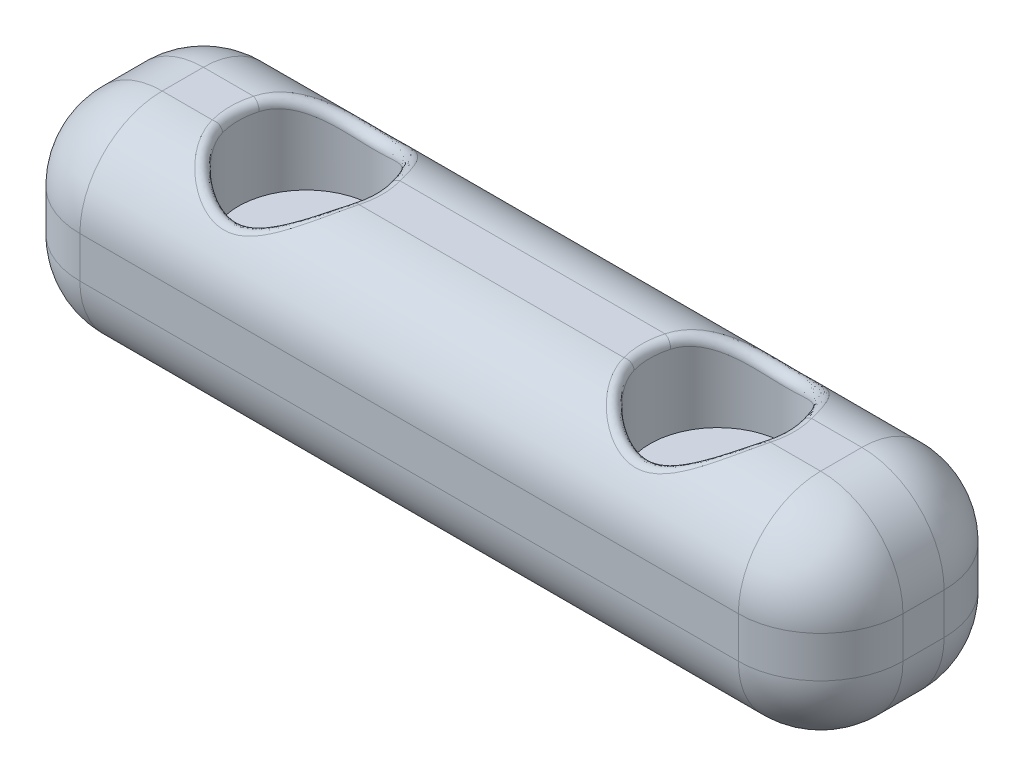
from build123d import *

# Parameters (mm, degrees)
SKETCH1_W           = 20
SKETCH1_H           = 5
BOSS_EXTRUDE1_DEPTH = 5
SKETCH2_R           = 1.65
CUT_EXTRUDE1_DEPTH  = 2
FILLET1_R           = 2
FILLET2_R           = 0.2


with BuildPart() as part:
    # Sketch1 → Boss-Extrude1 (new body)
    with BuildSketch(Plane(origin=(0, 0, 0), x_dir=(1, 0, 0), z_dir=(0, 1, 0))):
        with Locations((0.862068966, 0.646551724)):
            Rectangle(SKETCH1_W, SKETCH1_H)
    extrude(amount=BOSS_EXTRUDE1_DEPTH)

    # Sketch2 → Cut-Extrude1 (cut)
    with BuildSketch(Plane(origin=(0, 5, 0), x_dir=(1, 0, 0), z_dir=(0, 1, 0))):
        with Locations(Location((-4.137931034, 0.646551724, 0), (0, 0, 270))):
            Circle(SKETCH2_R)
        with Locations(Location((5.862068966, 0.646551724, 0), (0, 0, 270))):
            Circle(SKETCH2_R)
    extrude(amount=-CUT_EXTRUDE1_DEPTH, mode=Mode.SUBTRACT)

    # Fillet1
    # the kernel refuses this fillet: 2 mm, written as the material it takes off along each edge
    with BuildSketch(Plane(origin=(8.862068966, 3, -1.146551724), x_dir=(1, 0, 0), z_dir=(0, 0, -1))) as fillet1_piece_1_section:
        Polygon((0, 0), (FILLET1_R, 0), (FILLET1_R, -FILLET1_R), (0, -FILLET1_R), align=None)
    fillet1_piece_1 = extrude(amount=FILLET1_R, mode=Mode.PRIVATE)
    fillet1_piece_1 = fillet1_piece_1 - Plane(origin=(8.862068966, 3, -1.146551724), x_dir=(-0.7071067811865475, -0.7071067811865475, 0), z_dir=(0, 0, -1)) * Sphere(FILLET1_R, mode=Mode.PRIVATE)
    add(fillet1_piece_1, mode=Mode.SUBTRACT)
    with BuildSketch(Plane(origin=(8.862068966, 3, -0.146551724), x_dir=(0, 1, 0), z_dir=(1, 0, 0))) as fillet1_piece_2_section:
        Polygon((0, 0), (FILLET1_R, 0), (FILLET1_R, FILLET1_R), (0, FILLET1_R), align=None)
    fillet1_piece_2 = extrude(amount=FILLET1_R, mode=Mode.PRIVATE)
    fillet1_piece_2 = fillet1_piece_2 - Plane(origin=(8.862068966, 3, -0.146551724), x_dir=(0, -0.7071067811865475, -0.7071067811865475), z_dir=(1, 0, 0)) * Sphere(FILLET1_R, mode=Mode.PRIVATE)
    add(fillet1_piece_2, mode=Mode.SUBTRACT)
    with BuildSketch(Plane(origin=(-7.137931034, 3, -1.146551724), x_dir=(-1, 0, 0), z_dir=(0, 0, -1))) as fillet1_piece_3_section:
        Polygon((0, 0), (FILLET1_R, 0), (FILLET1_R, FILLET1_R), (0, FILLET1_R), align=None)
    fillet1_piece_3 = extrude(amount=FILLET1_R, mode=Mode.PRIVATE)
    fillet1_piece_3 = fillet1_piece_3 - Plane(origin=(-7.137931034, 3, -1.146551724), x_dir=(0.7071067811865475, -0.7071067811865475, 0), z_dir=(0, 0, -1)) * Sphere(FILLET1_R, mode=Mode.PRIVATE)
    add(fillet1_piece_3, mode=Mode.SUBTRACT)
    with BuildSketch(Plane(origin=(-7.137931034, 3, -0.146551724), x_dir=(0, 1, 0), z_dir=(-1, 0, 0))) as fillet1_piece_4_section:
        Polygon((0, 0), (FILLET1_R, 0), (FILLET1_R, -FILLET1_R), (0, -FILLET1_R), align=None)
    fillet1_piece_4 = extrude(amount=FILLET1_R, mode=Mode.PRIVATE)
    fillet1_piece_4 = fillet1_piece_4 - Plane(origin=(-7.137931034, 3, -0.146551724), x_dir=(0, -0.7071067811865475, -0.7071067811865475), z_dir=(-1, 0, 0)) * Sphere(FILLET1_R, mode=Mode.PRIVATE)
    add(fillet1_piece_4, mode=Mode.SUBTRACT)
    with BuildSketch(Plane(origin=(-7.137931034, 2, -1.146551724), x_dir=(-1, 0, 0), z_dir=(0, 0, -1))) as fillet1_piece_5_section:
        Polygon((0, 0), (FILLET1_R, 0), (FILLET1_R, -FILLET1_R), (0, -FILLET1_R), align=None)
    fillet1_piece_5 = extrude(amount=FILLET1_R, mode=Mode.PRIVATE)
    fillet1_piece_5 = fillet1_piece_5 - Plane(origin=(-7.137931034, 2, -1.146551724), x_dir=(0.7071067811865475, 0.7071067811865475, 0), z_dir=(0, 0, -1)) * Sphere(FILLET1_R, mode=Mode.PRIVATE)
    add(fillet1_piece_5, mode=Mode.SUBTRACT)
    with BuildSketch(Plane(origin=(8.862068966, 2, -1.146551724), x_dir=(1, 0, 0), z_dir=(0, 0, -1))) as fillet1_piece_6_section:
        Polygon((0, 0), (FILLET1_R, 0), (FILLET1_R, FILLET1_R), (0, FILLET1_R), align=None)
    fillet1_piece_6 = extrude(amount=FILLET1_R, mode=Mode.PRIVATE)
    fillet1_piece_6 = fillet1_piece_6 - Plane(origin=(8.862068966, 2, -1.146551724), x_dir=(-0.7071067811865475, 0.7071067811865475, 0), z_dir=(0, 0, -1)) * Sphere(FILLET1_R, mode=Mode.PRIVATE)
    add(fillet1_piece_6, mode=Mode.SUBTRACT)
    with BuildSketch(Plane(origin=(8.862068966, 2, -0.146551724), x_dir=(0, -1, 0), z_dir=(1, 0, 0))) as fillet1_piece_7_section:
        Polygon((0, 0), (FILLET1_R, 0), (FILLET1_R, -FILLET1_R), (0, -FILLET1_R), align=None)
    fillet1_piece_7 = extrude(amount=FILLET1_R, mode=Mode.PRIVATE)
    fillet1_piece_7 = fillet1_piece_7 - Plane(origin=(8.862068966, 2, -0.146551724), x_dir=(0, 0.7071067811865475, -0.7071067811865475), z_dir=(1, 0, 0)) * Sphere(FILLET1_R, mode=Mode.PRIVATE)
    add(fillet1_piece_7, mode=Mode.SUBTRACT)
    with BuildSketch(Plane(origin=(-7.137931034, 2, -0.146551724), x_dir=(0, -1, 0), z_dir=(-1, 0, 0))) as fillet1_piece_8_section:
        Polygon((0, 0), (FILLET1_R, 0), (FILLET1_R, FILLET1_R), (0, FILLET1_R), align=None)
    fillet1_piece_8 = extrude(amount=FILLET1_R, mode=Mode.PRIVATE)
    fillet1_piece_8 = fillet1_piece_8 - Plane(origin=(-7.137931034, 2, -0.146551724), x_dir=(0, 0.7071067811865475, -0.7071067811865475), z_dir=(-1, 0, 0)) * Sphere(FILLET1_R, mode=Mode.PRIVATE)
    add(fillet1_piece_8, mode=Mode.SUBTRACT)
    with BuildSketch(Plane(origin=(10.862068966, 5, -1.146551724), x_dir=(0, -1, 0), z_dir=(0, 0, 1)), Plane(origin=(-9.137931034, 5, -0.146551724), x_dir=(0, -1, 0), z_dir=(0, 0, -1)), Plane(origin=(-9.137931034, 2, -3.146551724), x_dir=(1, 0, 0), z_dir=(0, 1, 0)), Plane(origin=(-9.137931034, 2, 1.853448276), x_dir=(0, 0, -1), z_dir=(0, 1, 0))) as fillet1_piece_9:
        with BuildLine():
            CenterArc((FILLET1_R, -FILLET1_R), FILLET1_R, 90, 90)
            Line((0, -FILLET1_R), (0, 0))
            Line((0, 0), (FILLET1_R, 0))
        make_face()
    extrude(amount=1, mode=Mode.SUBTRACT)
    with BuildSketch(Plane(origin=(-7.137931034, 5, -3.146551724), x_dir=(0, -1, 0), z_dir=(1, 0, 0)), Plane(origin=(8.862068966, 0, 1.853448276), x_dir=(0, 0, -1), z_dir=(-1, 0, 0))) as fillet1_piece_10:
        with BuildLine():
            CenterArc((FILLET1_R, -FILLET1_R), FILLET1_R, 90, 90)
            Line((0, -FILLET1_R), (0, 0))
            Line((0, 0), (FILLET1_R, 0))
        make_face()
    extrude(amount=16, mode=Mode.SUBTRACT)
    with BuildSketch(Plane(origin=(-7.137931034, 0, -3.146551724), x_dir=(0, 1, 0), z_dir=(1, 0, 0)), Plane(origin=(8.862068966, 5, 1.853448276), x_dir=(0, 0, -1), z_dir=(-1, 0, 0))) as fillet1_piece_11:
        with BuildLine():
            CenterArc((FILLET1_R, FILLET1_R), FILLET1_R, 180, 90)
            Line((0, FILLET1_R), (0, 0))
            Line((0, 0), (FILLET1_R, 0))
        make_face()
    extrude(amount=16, mode=Mode.SUBTRACT)
    with BuildSketch(Plane(origin=(10.862068966, 0, -1.146551724), x_dir=(0, 1, 0), z_dir=(0, 0, 1)), Plane(origin=(-9.137931034, 0, -0.146551724), x_dir=(0, 1, 0), z_dir=(0, 0, -1)), Plane(origin=(10.862068966, 2, -3.146551724), x_dir=(-1, 0, 0), z_dir=(0, 1, 0)), Plane(origin=(10.862068966, 2, 1.853448276), x_dir=(0, 0, -1), z_dir=(0, 1, 0))) as fillet1_piece_12:
        with BuildLine():
            CenterArc((FILLET1_R, FILLET1_R), FILLET1_R, 180, 90)
            Line((0, FILLET1_R), (0, 0))
            Line((0, 0), (FILLET1_R, 0))
        make_face()
    extrude(amount=1, mode=Mode.SUBTRACT)

    # Fillet2
    fillet2_edges = [part.edges().sort_by_distance(p)[0] for p in [
        (-2.487931034, 5, -0.646551724),
        (7.512068966, 5, -0.646551724),
        (-5.787931034, 5, -0.646551724),
        (4.212068966, 5, -0.646551724),
        (-4.137931034, 4.636306817, -2.296551724),
        (-5.11183301, 4.818765151, 0.685369791),
        (5.862068966, 4.636306817, -2.296551724),
        (4.88816699, 4.818765151, 0.685369791),
    ]]
    fillet(fillet2_edges, radius=FILLET2_R)


solid = part.part
